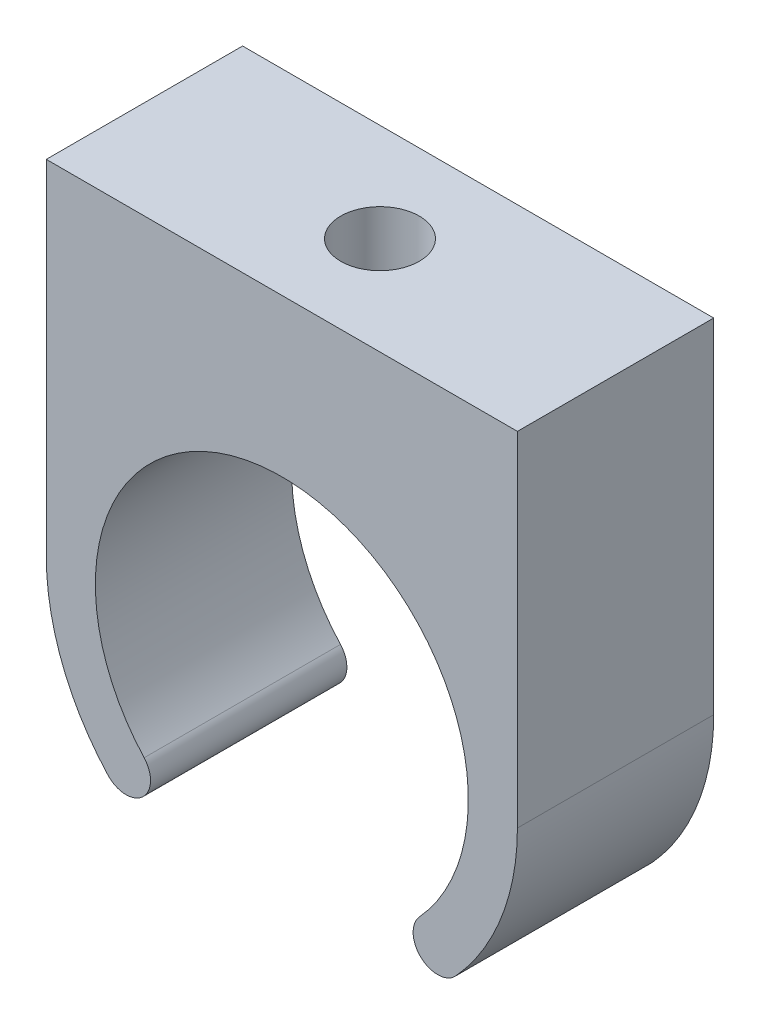
from build123d import *

# Parameters (mm, degrees)
BOSS_EXTRUDE2_DEPTH = 5
SKETCH5_R           = 2
CUT_EXTRUDE1_DEPTH  = 9
CUT_EXTRUDE2_DEPTH  = 8


with BuildPart() as part:
    # Sketch3 → Boss-Extrude2 (new, symmetric)
    with BuildSketch(Plane.XY):
        with BuildLine():
            Line((-12, -4.5), (-12, 13))
            Line((-12, 13), (12, 13))
            Line((12, 13), (12, -4.5))
            ThreePointArc((12, -4.5), (11.187544084, -8.840375258), (8.860190437, -12.593023256))
            ThreePointArc((8.860190437, -12.593023256), (7.094230677, -12.672936504), (7.014317429, -10.906976744))
            ThreePointArc((7.014317429, -10.906976744), (0, 5), (-7.014317429, -10.906976744))
            ThreePointArc((-7.014317429, -10.906976744), (-7.094230677, -12.672936504), (-8.860190437, -12.593023256))
            ThreePointArc((-8.860190437, -12.593023256), (-11.187544084, -8.840375258), (-12, -4.5))
        make_face()
    extrude(amount=BOSS_EXTRUDE2_DEPTH, both=True)

    # Sketch5 → Cut-Extrude1 (cut)
    with BuildSketch(Plane(origin=(0, 13, 0), x_dir=(1, 0, 0), z_dir=(0, 1, 0))):
        Circle(SKETCH5_R)
    extrude(amount=-CUT_EXTRUDE1_DEPTH, mode=Mode.SUBTRACT)

    # Sketch7 → Cut-Extrude2 (cut)
    with BuildSketch(Plane(origin=(0, 0, -5), x_dir=(-1, 0, 0), z_dir=(0, 0, -1))):
        with BuildLine():
            Line((10, 11.190527755), (10, 1.190527755))
            ThreePointArc((10, 1.190527755), (8.535533906, 4.726061661), (5, 6.190527755))
            Line((5, 6.190527755), (5, 11.190527755))
            Line((5, 11.190527755), (10, 11.190527755))
        make_face()
        with BuildLine():
            Line((-10, 11.190527755), (-10, 1.190527755))
            ThreePointArc((-10, 1.190527755), (-8.535533906, 4.726061661), (-5, 6.190527755))
            Line((-5, 6.190527755), (-5, 11.190527755))
            Line((-5, 11.190527755), (-10, 11.190527755))
        make_face()
    extrude(amount=-CUT_EXTRUDE2_DEPTH, mode=Mode.SUBTRACT)


solid = part.part
